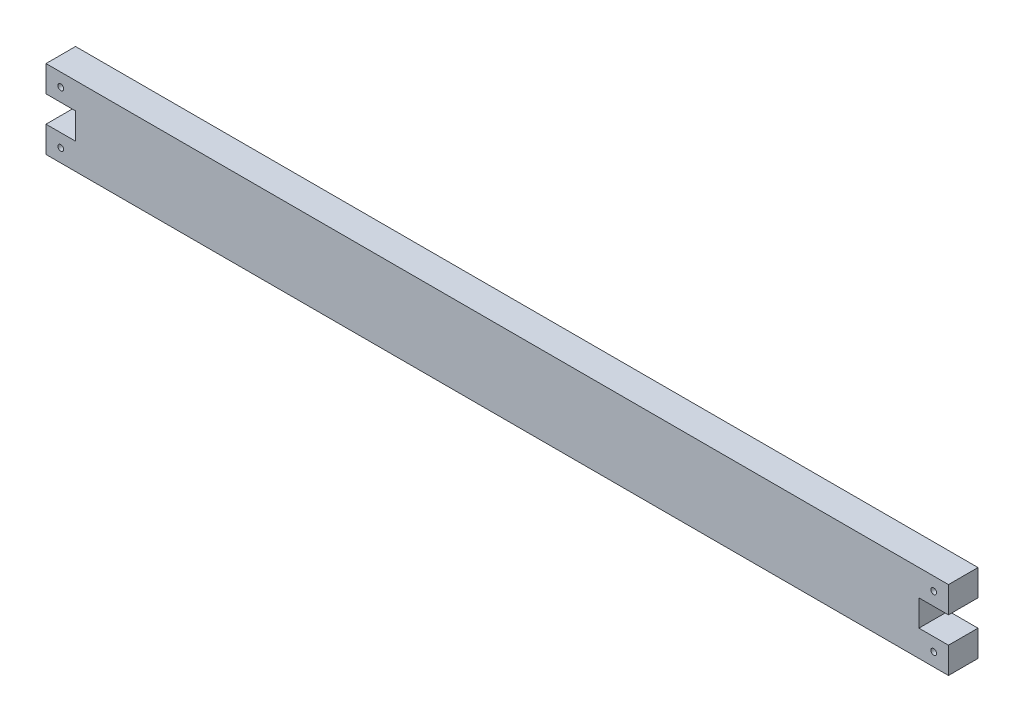
from build123d import *

# Parameters (mm, degrees)
SKETCH1_W             = 550
SKETCH1_H             = 48
EXTRUDE_361_DEPTH     = 18
CUT_EXTRUDE_576_REACH = 278.632
SKETCH2_W             = 18
SKETCH2_H             = 16
CUT_EXTRUDE_809_REACH = 278.632
SKETCH3_R             = 1.75


with BuildPart() as part:
    # Sketch1 → Extrude 361 (new body)
    with BuildSketch(Plane.XY):
        Rectangle(SKETCH1_W, SKETCH1_H)
    extrude(amount=EXTRUDE_361_DEPTH)

    # Sketch2 → Cut-Extrude 576 (cut, up to next)
    with BuildSketch(Plane.XY.offset(18), mode=Mode.PRIVATE) as cut_extrude_576_sk1:
        with Locations((-266, 0)):
            Rectangle(SKETCH2_W, SKETCH2_H)
    cut_extrude_576_tool1 = extrude(cut_extrude_576_sk1.sketch, amount=-CUT_EXTRUDE_576_REACH, mode=Mode.PRIVATE) & part.part
    cut_extrude_576 = cut_extrude_576_tool1.solids().sort_by_distance((-266, 0, 18))[0]
    add(cut_extrude_576, mode=Mode.SUBTRACT)

    # Sketch3 → Cut-Extrude 809 (cut, up to next)
    with BuildSketch(Plane.XY.offset(18), mode=Mode.PRIVATE) as cut_extrude_809_sk1:
        with Locations((-266, 16)):
            Circle(SKETCH3_R)
    cut_extrude_809_tool1 = extrude(cut_extrude_809_sk1.sketch, amount=-CUT_EXTRUDE_809_REACH, mode=Mode.PRIVATE) & part.part
    # Sketch3 → Cut-Extrude 809 (cut, up to next)
    with BuildSketch(Plane.XY.offset(18), mode=Mode.PRIVATE) as cut_extrude_809_sk2:
        with Locations((-266, -16)):
            Circle(SKETCH3_R)
    cut_extrude_809_tool2 = extrude(cut_extrude_809_sk2.sketch, amount=-CUT_EXTRUDE_809_REACH, mode=Mode.PRIVATE) & part.part
    cut_extrude_809_1 = cut_extrude_809_tool1.solids().sort_by_distance((-266, 16, 18))[0]
    add(cut_extrude_809_1, mode=Mode.SUBTRACT)
    cut_extrude_809_2 = cut_extrude_809_tool2.solids().sort_by_distance((-266, -16, 18))[0]
    add(cut_extrude_809_2, mode=Mode.SUBTRACT)
    cut_extrude_809 = cut_extrude_809_1 + cut_extrude_809_2  # Cut-Extrude 809 as one shape, for the pattern or mirror that repeats it

    # Mirror1: Cut-Extrude 576, Cut-Extrude 809 across plane
    add(cut_extrude_576.mirror(Plane(origin=(0, 0, 0), x_dir=(0, 0, 1), z_dir=(1, 0, 0))), mode=Mode.SUBTRACT)
    add(cut_extrude_809.mirror(Plane(origin=(0, 0, 0), x_dir=(0, 0, 1), z_dir=(1, 0, 0))), mode=Mode.SUBTRACT)


solid = part.part
